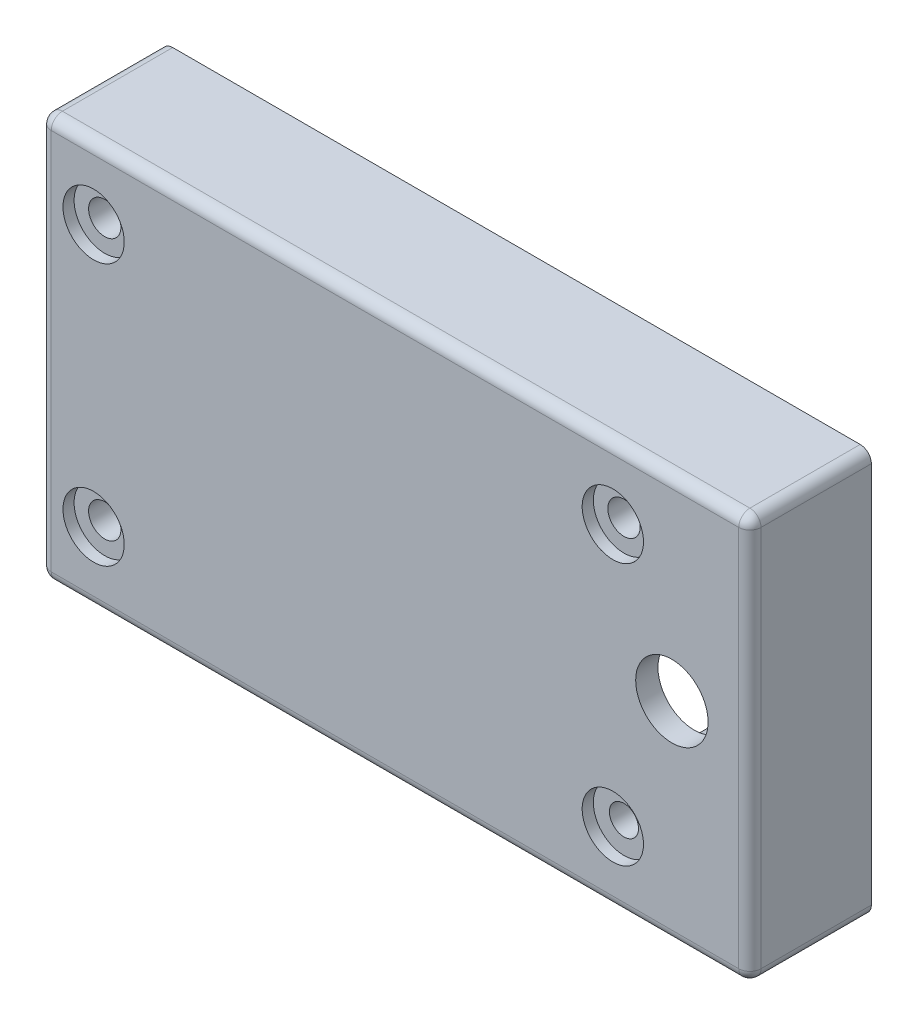
from build123d import *

# Parameters (mm, degrees)
CROQUIS2_R                = 2.4
CROQUIS2_R_2              = 1.45
SALIENTE_EXTRUIR2_DEPTH   = 12.3
SALIENTE_EXTRUIR2_2_DEPTH = 12.3
CROQUIS2_R_3              = 2.2627417
SALIENTE_EXTRUIR2_3_DEPTH = 12.3
CROQUIS2_R_4              = 1.304870774
SALIENTE_EXTRUIR2_4_DEPTH = 12.3
CROQUIS4_W                = 36.3
CROQUIS4_H                = 63.7
CROQUIS4_W_2              = 32.3
CROQUIS4_H_2              = 59.7
SALIENTE_EXTRUIR4_DEPTH   = 8.9
CROQUIS5_W                = 36.3
CROQUIS5_H                = 63.7
SALIENTE_EXTRUIR5_DEPTH   = 2
REDONDEO1_R               = 1
CROQUIS6_W                = 0.952491513
CROQUIS6_H                = 11.029714725
CORTAR_EXTRUIR1_DEPTH     = 1
REDONDEO2_R               = 1
CROQUIS7_R                = 1.45
CROQUIS7_R_2              = 1.304870774
CORTAR_EXTRUIR2_DEPTH     = 42.540563821
CROQUIS8_R                = 2.75
CORTAR_EXTRUIR3_DEPTH     = 1
CROQUIS9_R                = 3.250192478
CORTAR_EXTRUIR4_DEPTH     = 41.895212954
CROQUIS10_W               = 30.589236147
CROQUIS10_H               = 22.63620754
CROQUIS10_W_2             = 28.589236147
CROQUIS10_H_2             = 20.63620754
SALIENTE_EXTRUIR6_DEPTH   = 2.5


with BuildPart() as part:
    # Croquis2 → Saliente-Extruir2 (new body)
    with BuildSketch(Plane(origin=(-1.363345475, 4.236097797, 1), x_dir=(0, 1, 0), z_dir=(0, 0, 1))):
        with Locations(Location((-16.185020115, 23.120880637, 0), (0, 0, 270))):
            Circle(CROQUIS2_R)
        with Locations(Location((-16.185020115, 23.120880637, 0), (0, 0, 270))):
            Circle(CROQUIS2_R_2, mode=Mode.SUBTRACT)
    extrude(amount=-SALIENTE_EXTRUIR2_DEPTH)



with BuildPart() as body_2:
    # Croquis2 → Saliente-Extruir2 2 (new body)
    with BuildSketch(Plane(origin=(-1.363345475, 4.236097797, 1), x_dir=(0, 1, 0), z_dir=(0, 0, 1))):
        with Locations(Location((7.314979885, 23.120880637, 0), (0, 0, 270))):
            Circle(CROQUIS2_R)
        with Locations(Location((7.314979885, 23.120880637, 0), (0, 0, 270))):
            Circle(CROQUIS2_R_2, mode=Mode.SUBTRACT)
    extrude(amount=-SALIENTE_EXTRUIR2_2_DEPTH)


with BuildPart() as body_3:
    # Croquis2 → Saliente-Extruir2 3 (new body)
    with BuildSketch(Plane(origin=(-1.363345475, 4.236097797, 1), x_dir=(0, 1, 0), z_dir=(0, 0, 1))):
        with Locations(Location((7.314979885, -23.479119363, 0), (0, 0, 270))):
            Circle(CROQUIS2_R_3)
        with Locations(Location((7.314979885, -23.479119363, 0), (0, 0, 270))):
            Circle(CROQUIS2_R_2, mode=Mode.SUBTRACT)
    extrude(amount=-SALIENTE_EXTRUIR2_3_DEPTH)


with BuildPart() as body_4:
    # Croquis2 → Saliente-Extruir2 4 (new body)
    with BuildSketch(Plane(origin=(-1.363345475, 4.236097797, 1), x_dir=(0, 1, 0), z_dir=(0, 0, 1))):
        with Locations(Location((-16.185020115, -23.479119363, 0), (0, 0, 270))):
            Circle(CROQUIS2_R)
        with Locations(Location((-16.185020115, -23.479119363, 0), (0, 0, 270))):
            Circle(CROQUIS2_R_4, mode=Mode.SUBTRACT)
    extrude(amount=-SALIENTE_EXTRUIR2_4_DEPTH)


with BuildPart() as body_5:
    # Croquis4 → Saliente-Extruir4 (new body)
    with BuildSketch(Plane(origin=(-1.363345475, 4.236097797, 1), x_dir=(0, 1, 0), z_dir=(0, 0, 1))):
        with Locations((-4.435020115, -3.929119363)):
            Rectangle(CROQUIS4_W, CROQUIS4_H)
        with Locations((-4.435020115, -3.929119363)):
            Rectangle(CROQUIS4_W_2, CROQUIS4_H_2, mode=Mode.SUBTRACT)
    extrude(amount=-SALIENTE_EXTRUIR4_DEPTH)


with BuildPart() as part_1:
    add(part.part)

    add(body_2.part)  # Saliente-Extruir5 merges body 2

    add(body_3.part)  # Saliente-Extruir5 merges body 3

    add(body_4.part)  # Saliente-Extruir5 merges body 4

    add(body_5.part)  # Saliente-Extruir5 merges body 5
    # Croquis5 → Saliente-Extruir5 (add)
    with BuildSketch(Plane(origin=(-1.363345475, 4.236097797, 1), x_dir=(0, 1, 0), z_dir=(0, 0, 1))):
        with Locations((-4.435020115, -3.929119363)):
            Rectangle(CROQUIS5_W, CROQUIS5_H)
    extrude(amount=SALIENTE_EXTRUIR5_DEPTH)

    # Redondeo1
    redondeo1_edges = [part_1.edges().sort_by_distance(p)[0] for p in [
        (-29.284226112, -18.348922317, -2.45),
        (34.415773888, -18.348922317, -2.45),
        (34.415773888, 17.951077683, -2.45),
        (-29.284226112, 17.951077683, -2.45),
        (2.565773888, -18.348922317, 3),
        (34.415773888, -0.198922317, 3),
        (2.565773888, 17.951077683, 3),
        (-29.284226112, -0.198922317, 3),
    ]]
    fillet(redondeo1_edges, radius=REDONDEO1_R)

    # Croquis6 → Cortar-Extruir1 (cut)
    with BuildSketch(Plane.ZY.offset(29.284226112)):
        with Locations((-7.423754244, -0.221239115)):
            Rectangle(CROQUIS6_W, CROQUIS6_H)
    extrude(amount=-CORTAR_EXTRUIR1_DEPTH, mode=Mode.SUBTRACT)

    # Redondeo2
    redondeo2_edges = [part_1.edges().sort_by_distance(p)[0] for p in [
        (-29.284226112, -5.736096478, -7.423754243),
        (-29.284226112, 5.293618247, -7.423754243),
        (-29.284226112, -0.221239116, -6.947508487),
    ]]
    fillet(redondeo2_edges, radius=REDONDEO2_R - 0.0001)  # a hair under: the kernel refuses the full size

    # Croquis7 → Cortar-Extruir2 (cut, through all)
    with BuildSketch(Plane(origin=(0, 0, -11.3), x_dir=(-1, 0, 0), z_dir=(0, 0, -1))):
        with Locations(Location((24.484226112, 11.551077683, 0), (0, 0, 180))):
            Circle(CROQUIS7_R)
        with Locations(Location((24.484226112, -11.948922317, 0), (0, 0, 180))):
            Circle(CROQUIS7_R)
        with Locations(Location((-22.115773888, -11.948922317, 0), (0, 0, 180))):
            Circle(CROQUIS7_R_2)
        with Locations(Location((-22.115773888, 11.551077683, 0), (0, 0, 90))):
            Circle(CROQUIS7_R)
    extrude(amount=-CORTAR_EXTRUIR2_DEPTH, mode=Mode.SUBTRACT)

    # Croquis8 → Cortar-Extruir3 (cut)
    with BuildSketch(Plane.XY.offset(3)):
        with Locations((-24.484226112, -11.948922317)):
            Circle(CROQUIS8_R)
        with Locations((-24.484226112, 11.551077683)):
            Circle(CROQUIS8_R)
        with Locations((22.115773888, -11.948922317)):
            Circle(CROQUIS8_R)
        with Locations((22.115773888, 11.551077683)):
            Circle(CROQUIS8_R)
    extrude(amount=-CORTAR_EXTRUIR3_DEPTH, mode=Mode.SUBTRACT)

    # Croquis9 → Cortar-Extruir4 (cut, through all)
    with BuildSketch(Plane(origin=(0, 0, 1), x_dir=(-1, 0, 0), z_dir=(0, 0, -1))):
        with Locations((-27.415773888, 0.451077683)):
            Circle(CROQUIS9_R)
    extrude(amount=-CORTAR_EXTRUIR4_DEPTH, mode=Mode.SUBTRACT)

    # Croquis10 → Saliente-Extruir6 (add)
    with BuildSketch(Plane(origin=(0, 0, 1), x_dir=(-1, 0, 0), z_dir=(0, 0, -1))):
        with Locations((0.23483353, -0.007358301)):
            Rectangle(CROQUIS10_W, CROQUIS10_H)
        with Locations((0.234833529, -0.007358301)):
            Rectangle(CROQUIS10_W_2, CROQUIS10_H_2, mode=Mode.SUBTRACT)
    extrude(amount=SALIENTE_EXTRUIR6_DEPTH)


solid = part_1.part
